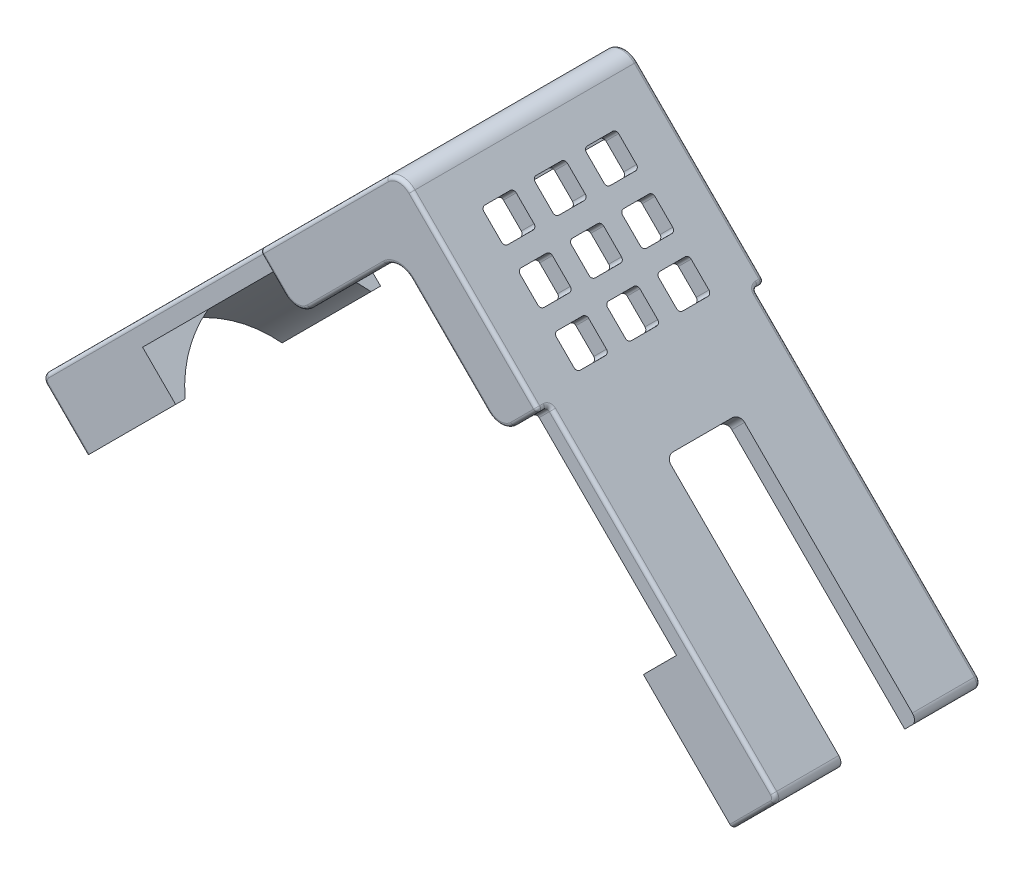
from build123d import *

# Parameters (mm, degrees)
EXTRUDE_1_DEPTH     = 57
CUT_EXTRUDE_1_DEPTH = 57
EXTRUDE_2_DEPTH     = 3
SKETCH_4_W          = 20.470466532
SKETCH_4_H          = 70
CUT_EXTRUDE_2_DEPTH = 5
FILLET_1_R          = 5
FILLET_2_R          = 5
FILLET_3_R          = 2
FILLET_4_R          = 1
FILLET_5_R          = 1
FILLET_6_R          = 2


with BuildPart() as part:
    # 草图1 → 凸台-拉伸1 (new body)
    with BuildSketch(Plane.XY):
        Polygon((0, 0), (0, 7.071067812), (-102.530483272, -95.45941546), (-98.994949366, -98.994949366), (-74.246212025, -74.246212025), align=None)
        Polygon((-60.104076401, -88.388347648), (-74.246212025, -74.246212025), (-98.994949366, -98.994949366), (-84.852813742, -113.13708499), align=None)
        Polygon((102.530483272, -95.45941546), (0, 7.071067812), (0, 0), (74.246212025, -74.246212025), (98.994949366, -98.994949366), align=None)
        Polygon((98.994949366, -98.994949366), (74.246212025, -74.246212025), (60.104076401, -88.388347648), (84.852813742, -113.13708499), align=None)
    extrude(amount=EXTRUDE_1_DEPTH)

    # 草图2 → 切除-拉伸1 (cut)
    with BuildSketch(Plane(origin=(-98.994949366, -98.994949366, 0), x_dir=(0, 0, 1), z_dir=(-0.7071067811865446, -0.7071067811865506, 0))):
        with BuildLine():
            ThreePointArc((0, -18.832503002), (-1.122626487, -23.45658351), (-1.5, -28.2))
            ThreePointArc((-1.5, -28.2), (28.5, -58.2), (58.5, -28.2))
            ThreePointArc((58.5, -28.2), (58.122626487, -23.45658351), (57, -18.832503002))
            Line((57, -18.832503002), (57, -20))
            Line((57, -20), (0, -20))
            Line((0, -20), (0, -18.832503002))
        make_face()
        with BuildLine():
            Line((54.364261057, -13), (2.635738943, -13))
            ThreePointArc((2.635738943, -13), (1.161881139, -15.845759549), (0, -18.832503002))
            Line((0, -18.832503002), (0, -20))
            Line((0, -20), (57, -20))
            Line((57, -20), (57, -18.832503002))
            ThreePointArc((57, -18.832503002), (55.838118861, -15.845759549), (54.364261057, -13))
        make_face()
        with BuildLine():
            Line((2.635738943, -13), (0, -13))
            Line((0, -13), (0, -18.832503002))
            ThreePointArc((0, -18.832503002), (1.161881139, -15.845759549), (2.635738943, -13))
        make_face()
        with BuildLine():
            ThreePointArc((54.364261057, -13), (28.5, 1.8), (2.635738943, -13))
            Line((2.635738943, -13), (54.364261057, -13))
        make_face()
        with BuildLine():
            Line((57, -13), (54.364261057, -13))
            ThreePointArc((54.364261057, -13), (55.838118861, -15.845759549), (57, -18.832503002))
            Line((57, -18.832503002), (57, -13))
        make_face()
    cut_extrude_1 = extrude(amount=-CUT_EXTRUDE_1_DEPTH, mode=Mode.SUBTRACT)

    # 镜向1: 切除-拉伸1 across plane
    add(cut_extrude_1.mirror(Plane(origin=(0, 0, 0), x_dir=(0, 0, 1), z_dir=(1, 0, 0))), mode=Mode.SUBTRACT)

    # 草图3 → 凸台-拉伸2 (add)
    with BuildSketch(Plane(origin=(0, 0, 0), x_dir=(-1, 0, 0), z_dir=(0, 0, -1))):
        Polygon((0, 7.071067812), (-38.890872965, -31.819805153), (-28.284271247, -42.426406871), (0, -14.142135624), (28.284271247, -42.426406871), (38.890872965, -31.819805153), align=None)
    extrude_2 = extrude(amount=EXTRUDE_2_DEPTH)

    # 镜向2: 凸台-拉伸2 across plane
    add(extrude_2.mirror(Plane(origin=(0, 0, 28.5), x_dir=(1, 0, 0), z_dir=(0, 0, -1))))

    # 草图4 → 切除-拉伸2 (cut)
    with BuildSketch(Plane(origin=(0, 0, 0), x_dir=(0, 0, -1), z_dir=(0.7071067811865465, -0.7071067811865487, 0))):
        with Locations((-28.5, -105)):
            Rectangle(SKETCH_4_W, SKETCH_4_H)
        with BuildLine():
            Line((-46.25, -9.45), (-39.25, -9.45))
            ThreePointArc((-39.25, -9.45), (-38.542893219, -9.742893219), (-38.25, -10.45))
            Line((-38.25, -10.45), (-38.25, -17.45))
            ThreePointArc((-38.25, -17.45), (-38.542893219, -18.157106781), (-39.25, -18.45))
            Line((-39.25, -18.45), (-46.25, -18.45))
            ThreePointArc((-46.25, -18.45), (-46.957106781, -18.157106781), (-47.25, -17.45))
            Line((-47.25, -17.45), (-47.25, -10.45))
            ThreePointArc((-47.25, -10.45), (-46.957106781, -9.742893219), (-46.25, -9.45))
        make_face()
        with BuildLine():
            Line((-24, -10.45), (-24, -17.45))
            ThreePointArc((-24, -17.45), (-24.292893219, -18.157106781), (-25, -18.45))
            Line((-25, -18.45), (-32, -18.45))
            ThreePointArc((-32, -18.45), (-32.707106781, -18.157106781), (-33, -17.45))
            Line((-33, -17.45), (-33, -10.45))
            ThreePointArc((-33, -10.45), (-32.707106781, -9.742893219), (-32, -9.45))
            Line((-32, -9.45), (-25, -9.45))
            ThreePointArc((-25, -9.45), (-24.292893219, -9.742893219), (-24, -10.45))
        make_face()
        with BuildLine():
            Line((-9.75, -10.45), (-9.75, -17.45))
            ThreePointArc((-9.75, -17.45), (-10.042893219, -18.157106781), (-10.75, -18.45))
            Line((-10.75, -18.45), (-17.75, -18.45))
            ThreePointArc((-17.75, -18.45), (-18.457106781, -18.157106781), (-18.75, -17.45))
            Line((-18.75, -17.45), (-18.75, -10.45))
            ThreePointArc((-18.75, -10.45), (-18.457106781, -9.742893219), (-17.75, -9.45))
            Line((-17.75, -9.45), (-10.75, -9.45))
            ThreePointArc((-10.75, -9.45), (-10.042893219, -9.742893219), (-9.75, -10.45))
        make_face()
        with BuildLine():
            Line((-24, -24.7), (-24, -31.7))
            ThreePointArc((-24, -31.7), (-24.292893219, -32.407106781), (-25, -32.7))
            Line((-25, -32.7), (-32, -32.7))
            ThreePointArc((-32, -32.7), (-32.707106781, -32.407106781), (-33, -31.7))
            Line((-33, -31.7), (-33, -24.7))
            ThreePointArc((-33, -24.7), (-32.707106781, -23.992893219), (-32, -23.7))
            Line((-32, -23.7), (-25, -23.7))
            ThreePointArc((-25, -23.7), (-24.292893219, -23.992893219), (-24, -24.7))
        make_face()
        with BuildLine():
            Line((-9.75, -24.7), (-9.75, -31.7))
            ThreePointArc((-9.75, -31.7), (-10.042893219, -32.407106781), (-10.75, -32.7))
            Line((-10.75, -32.7), (-17.75, -32.7))
            ThreePointArc((-17.75, -32.7), (-18.457106781, -32.407106781), (-18.75, -31.7))
            Line((-18.75, -31.7), (-18.75, -24.7))
            ThreePointArc((-18.75, -24.7), (-18.457106781, -23.992893219), (-17.75, -23.7))
            Line((-17.75, -23.7), (-10.75, -23.7))
            ThreePointArc((-10.75, -23.7), (-10.042893219, -23.992893219), (-9.75, -24.7))
        make_face()
        with BuildLine():
            Line((-24, -38.95), (-24, -45.95))
            ThreePointArc((-24, -45.95), (-24.292893219, -46.657106781), (-25, -46.95))
            Line((-25, -46.95), (-32, -46.95))
            ThreePointArc((-32, -46.95), (-32.707106781, -46.657106781), (-33, -45.95))
            Line((-33, -45.95), (-33, -38.95))
            ThreePointArc((-33, -38.95), (-32.707106781, -38.242893219), (-32, -37.95))
            Line((-32, -37.95), (-25, -37.95))
            ThreePointArc((-25, -37.95), (-24.292893219, -38.242893219), (-24, -38.95))
        make_face()
        with BuildLine():
            Line((-9.75, -38.95), (-9.75, -45.95))
            ThreePointArc((-9.75, -45.95), (-10.042893219, -46.657106781), (-10.75, -46.95))
            Line((-10.75, -46.95), (-17.75, -46.95))
            ThreePointArc((-17.75, -46.95), (-18.457106781, -46.657106781), (-18.75, -45.95))
            Line((-18.75, -45.95), (-18.75, -38.95))
            ThreePointArc((-18.75, -38.95), (-18.457106781, -38.242893219), (-17.75, -37.95))
            Line((-17.75, -37.95), (-10.75, -37.95))
            ThreePointArc((-10.75, -37.95), (-10.042893219, -38.242893219), (-9.75, -38.95))
        make_face()
        with BuildLine():
            Line((-38.25, -24.7), (-38.25, -31.7))
            ThreePointArc((-38.25, -31.7), (-38.542893219, -32.407106781), (-39.25, -32.7))
            Line((-39.25, -32.7), (-46.25, -32.7))
            ThreePointArc((-46.25, -32.7), (-46.957106781, -32.407106781), (-47.25, -31.7))
            Line((-47.25, -31.7), (-47.25, -24.7))
            ThreePointArc((-47.25, -24.7), (-46.957106781, -23.992893219), (-46.25, -23.7))
            Line((-46.25, -23.7), (-39.25, -23.7))
            ThreePointArc((-39.25, -23.7), (-38.542893219, -23.992893219), (-38.25, -24.7))
        make_face()
        with BuildLine():
            Line((-38.25, -38.95), (-38.25, -45.95))
            ThreePointArc((-38.25, -45.95), (-38.542893219, -46.657106781), (-39.25, -46.95))
            Line((-39.25, -46.95), (-46.25, -46.95))
            ThreePointArc((-46.25, -46.95), (-46.957106781, -46.657106781), (-47.25, -45.95))
            Line((-47.25, -45.95), (-47.25, -38.95))
            ThreePointArc((-47.25, -38.95), (-46.957106781, -38.242893219), (-46.25, -37.95))
            Line((-46.25, -37.95), (-39.25, -37.95))
            ThreePointArc((-39.25, -37.95), (-38.542893219, -38.242893219), (-38.25, -38.95))
        make_face()
    cut_extrude_2 = extrude(amount=-CUT_EXTRUDE_2_DEPTH, mode=Mode.SUBTRACT)

    # 镜向3: 切除-拉伸2 across plane
    add(cut_extrude_2.mirror(Plane(origin=(0, 0, 0), x_dir=(0, 0, 1), z_dir=(1, 0, 0))), mode=Mode.SUBTRACT)

    # 圆角1
    fillet_1_edges = [part.edges().sort_by_distance(p)[0] for p in [
        (0, 7.071067812, 28.5),
    ]]
    fillet(fillet_1_edges, radius=FILLET_1_R)

    # 圆角2
    fillet_2_edges = [part.edges().sort_by_distance(p)[0] for p in [
        (28.284271247, -42.426406871, -1.5),
        (0, -14.142135624, -1.5),
        (-28.284271247, -42.426406871, -1.5),
        (-28.284271247, -42.426406871, 58.5),
        (0, -14.142135624, 58.5),
        (28.284271247, -42.426406871, 58.5),
    ]]
    fillet(fillet_2_edges, radius=FILLET_2_R)

    # 圆角3
    fillet_3_edges = [part.edges().sort_by_distance(p)[0] for p in [
        (-102.530483272, -95.45941546, 9.132383367),
        (-102.530483272, -95.45941546, 47.867616633),
        (102.530483272, -95.45941546, 47.867616633),
        (102.530483272, -95.45941546, 9.132383367),
    ]]
    fillet(fillet_3_edges, radius=FILLET_3_R)

    # 圆角4
    # the kernel refuses this fillet: 1 mm, written as the material it adds along each edge
    with BuildSketch(Plane(origin=(-35.355339059, -35.355339059, 0), x_dir=(0, 0, -1), z_dir=(-0.7071067811865467, 0.7071067811865483, 0))) as fillet_4_piece_1:
        with BuildLine():
            CenterArc((FILLET_4_R, FILLET_4_R), FILLET_4_R, 180, 90)
            Line((0, FILLET_4_R), (0, 0))
            Line((0, 0), (FILLET_4_R, 0))
        make_face()
    extrude(amount=5)
    with BuildSketch(Plane(origin=(38.890872965, -31.819805153, 0), x_dir=(0.707106781186548, -0.7071067811865469, 0), z_dir=(-0.707106781186547, -0.7071067811865481, 0)), Plane(origin=(-35.355339059, -35.355339059, 57), x_dir=(0, 0, 1), z_dir=(-0.7071067811865467, 0.7071067811865483, 0)), Plane(origin=(38.890872965, -31.819805153, 57), x_dir=(0, 0, 1), z_dir=(-0.707106781186547, -0.7071067811865481, 0))) as fillet_4_piece_2:
        with BuildLine():
            CenterArc((FILLET_4_R, -FILLET_4_R), FILLET_4_R, 90, 90)
            Line((0, -FILLET_4_R), (0, 0))
            Line((0, 0), (FILLET_4_R, 0))
        make_face()
    extrude(amount=5)
    # the kernel refuses this fillet: 1 mm, written as the material it takes off along each edge
    with BuildSketch(Plane(origin=(40.658639918, -30.0520382, -3), x_dir=(0, 0, 1), z_dir=(-0.707106781186547, -0.7071067811865481, 0)), Plane(origin=(40.658639918, -30.0520382, 60), x_dir=(-0.7071067811865481, 0.707106781186547, 0), z_dir=(-0.707106781186547, -0.7071067811865481, 0)), Plane(origin=(-31.819805153, -38.890872965, 60), x_dir=(0.7071067811865485, 0.7071067811865467, 0), z_dir=(-0.7071067811865467, 0.7071067811865483, 0))) as fillet_4_2_piece_1:
        with BuildLine():
            CenterArc((FILLET_4_R, FILLET_4_R), FILLET_4_R, 180, 90)
            Line((0, FILLET_4_R), (0, 0))
            Line((0, 0), (FILLET_4_R, 0))
        make_face()
    extrude(amount=12.5, mode=Mode.SUBTRACT)
    with BuildSketch(Plane(origin=(-3.535533906, -17.67766953, 60), x_dir=(-0.7071067811865477, 0.7071067811865475, 0), z_dir=(-0.7071067811865475, -0.7071067811865476, 0)), Plane(origin=(24.748737342, -38.890872965, 60), x_dir=(0.7071067811865478, 0.7071067811865474, 0), z_dir=(-0.7071067811865474, 0.7071067811865478, 0))) as fillet_4_2_piece_2:
        with BuildLine():
            CenterArc((FILLET_4_R, FILLET_4_R), FILLET_4_R, 180, 90)
            Line((0, FILLET_4_R), (0, 0))
            Line((0, 0), (FILLET_4_R, 0))
        make_face()
    extrude(amount=30, mode=Mode.SUBTRACT)
    with BuildSketch(Plane(origin=(28.284271247, -35.355339059, 60), x_dir=(0.7071067811865479, -0.7071067811865471, 0), z_dir=(0.7071067811865471, 0.7071067811865479, 0))) as fillet_4_2_piece_3:
        with BuildLine():
            CenterArc((5 - FILLET_4_R, FILLET_4_R), FILLET_4_R, 270, 90)
            Line((5, FILLET_4_R), (5, 0))
            Line((5, 0), (5 - FILLET_4_R, 0))
        make_face()
    revolve(axis=Axis((28.284271247, -35.355339059, 60), (0, 0, -1)), revolution_arc=90, mode=Mode.SUBTRACT)
    with BuildSketch(Plane(origin=(-28.284271247, -35.355339059, 60), x_dir=(-0.707106781186549, -0.7071067811865461, 0), z_dir=(-0.7071067811865461, 0.707106781186549, 0))) as fillet_4_2_piece_4:
        with BuildLine():
            CenterArc((5 - FILLET_4_R, -FILLET_4_R), FILLET_4_R, 0, 90)
            Line((5, -FILLET_4_R), (5, 0))
            Line((5, 0), (5 - FILLET_4_R, 0))
        make_face()
    revolve(axis=Axis((-28.284271247, -35.355339059, 60), (0, 0, 1)), revolution_arc=90, mode=Mode.SUBTRACT)
    with BuildSketch(Plane(origin=(-31.819805153, -38.890872965, -3), x_dir=(0.7071067811865485, 0.7071067811865467, 0), z_dir=(-0.7071067811865467, 0.7071067811865483, 0))) as fillet_4_2_piece_5:
        with BuildLine():
            CenterArc((FILLET_4_R, -FILLET_4_R), FILLET_4_R, 90, 90)
            Line((0, -FILLET_4_R), (0, 0))
            Line((0, 0), (FILLET_4_R, 0))
        make_face()
    extrude(amount=12.5, mode=Mode.SUBTRACT)
    with BuildSketch(Plane(origin=(-3.535533906, -17.67766953, -3), x_dir=(-0.7071067811865477, 0.7071067811865475, 0), z_dir=(-0.7071067811865475, -0.7071067811865476, 0)), Plane(origin=(24.748737342, -38.890872965, -3), x_dir=(0.7071067811865478, 0.7071067811865474, 0), z_dir=(-0.7071067811865474, 0.7071067811865478, 0))) as fillet_4_2_piece_6:
        with BuildLine():
            CenterArc((FILLET_4_R, -FILLET_4_R), FILLET_4_R, 90, 90)
            Line((0, -FILLET_4_R), (0, 0))
            Line((0, 0), (FILLET_4_R, 0))
        make_face()
    extrude(amount=30, mode=Mode.SUBTRACT)
    with BuildSketch(Plane(origin=(28.284271247, -35.355339059, -3), x_dir=(0.7071067811865476, -0.7071067811865476, 0), z_dir=(0.7071067811865476, 0.7071067811865476, 0))) as fillet_4_2_piece_7:
        with BuildLine():
            CenterArc((5 - FILLET_4_R, -FILLET_4_R), FILLET_4_R, 0, 90)
            Line((5, -FILLET_4_R), (5, 0))
            Line((5, 0), (5 - FILLET_4_R, 0))
        make_face()
    revolve(axis=Axis((28.284271247, -35.355339059, -3), (0, 0, -1)), revolution_arc=90, mode=Mode.SUBTRACT)
    with BuildSketch(Plane(origin=(-28.284271247, -35.355339059, -3), x_dir=(-0.707106781186549, -0.7071067811865461, 0), z_dir=(-0.7071067811865461, 0.707106781186549, 0))) as fillet_4_2_piece_8:
        with BuildLine():
            CenterArc((5 - FILLET_4_R, FILLET_4_R), FILLET_4_R, 270, 90)
            Line((5, FILLET_4_R), (5, 0))
            Line((5, 0), (5 - FILLET_4_R, 0))
        make_face()
    revolve(axis=Axis((-28.284271247, -35.355339059, -3), (0, 0, 1)), revolution_arc=90, mode=Mode.SUBTRACT)
    with BuildSketch(Plane(origin=(0, -21.213203436, 60), x_dir=(0.7071067811865476, 0.7071067811865476, 0), z_dir=(0.7071067811865476, -0.7071067811865476, 0))) as fillet_4_2_piece_9:
        with BuildLine():
            CenterArc((5 + FILLET_4_R, -FILLET_4_R), FILLET_4_R, 90, 90)
            Line((5, -FILLET_4_R), (5, 0))
            Line((5, 0), (5 + FILLET_4_R, 0))
        make_face()
    revolve(axis=Axis((0, -21.213203436, 60), (0, 0, 1)), revolution_arc=90, mode=Mode.SUBTRACT)
    with BuildSketch(Plane(origin=(0, -21.213203436, -3), x_dir=(0.7071067811865476, 0.7071067811865475, 0), z_dir=(0.7071067811865475, -0.7071067811865476, 0))) as fillet_4_2_piece_10:
        with BuildLine():
            CenterArc((5 + FILLET_4_R, FILLET_4_R), FILLET_4_R, 180, 90)
            Line((5, FILLET_4_R), (5, 0))
            Line((5, 0), (5 + FILLET_4_R, 0))
        make_face()
    revolve(axis=Axis((0, -21.213203436, -3), (0, 0, 1)), revolution_arc=90, mode=Mode.SUBTRACT)

    # 圆角5
    fillet_5_edges = [part.edges().sort_by_distance(p)[0] for p in [
        (-95.45941546, -102.530483272, 0),
        (-95.45941546, -102.530483272, 57),
        (20.859650045, -13.788582233, -3),
        (0, 5, -3),
        (20.859650045, -13.788582233, 60),
        (0, 5, 60),
        (95.45941546, -102.530483272, 0),
        (95.45941546, -102.530483272, 57),
        (-70.357124728, -63.286056916, 0),
        (-70.357124728, -63.286056916, 57),
        (-101.702056147, -95.45941546, 57),
        (-101.702056147, -95.45941546, 0),
        (70.357124728, -63.286056916, 57),
        (70.357124728, -63.286056916, 0),
        (101.702056147, -95.45941546, 57),
        (101.702056147, -95.45941546, 0),
        (38.890872965, -31.819805153, 58.5),
        (-20.859650045, -13.788582233, 60),
        (38.890872965, -31.819805153, -1.5),
        (38.683766184, -31.612698372, -2.707106781),
        (38.683766184, -31.612698372, 59.707106781),
        (-20.859650045, -13.788582233, -3),
        (-38.890872965, -31.819805153, 58.5),
        (-38.890872965, -31.819805153, -1.5),
        (-38.683766184, -31.612698372, -2.707106781),
        (-38.683766184, -31.612698372, 59.707106781),
        (39.097979746, -32.026911935, 57.292893219),
        (-39.097979746, -32.026911935, 57.292893219),
        (39.097979746, -32.026911935, -0.292893219),
        (-39.097979746, -32.026911935, -0.292893219),
    ]]
    fillet(fillet_5_edges, radius=FILLET_5_R)

    # 圆角6
    fillet_6_edges = [part.edges().sort_by_distance(p)[0] for p in [
        (-51.265241636, -47.72970773, 38.735233266),
        (-51.265241636, -47.72970773, 18.264766734),
        (51.265241636, -47.72970773, 38.735233266),
        (51.265241636, -47.72970773, 18.264766734),
    ]]
    fillet(fillet_6_edges, radius=FILLET_6_R)


solid = part.part
